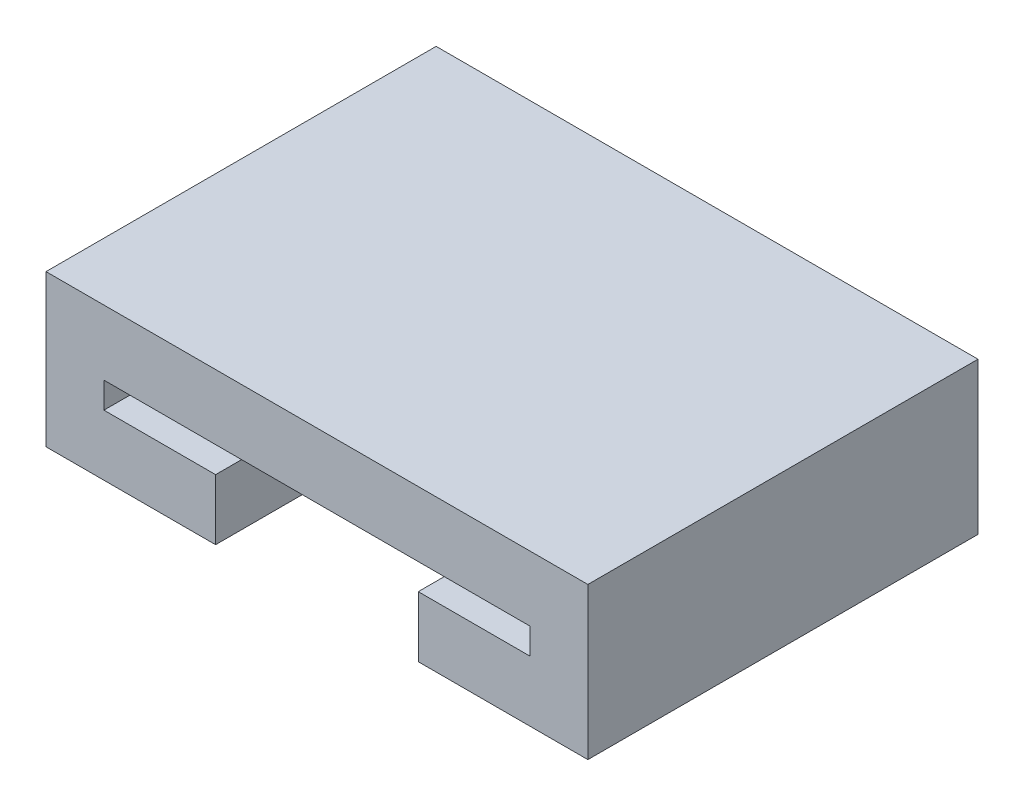
from build123d import *

# Parameters (mm, degrees)
SKETCH1_W           = 25
SKETCH1_H           = 18
BOSS_EXTRUDE1_DEPTH = 7
CUT_EXTRUDE1_DEPTH  = 13.5
SKETCH8_W           = 0.3
SKETCH8_H           = 2.8
CUT_EXTRUDE4_DEPTH  = 10


with BuildPart() as part:
    # Sketch1 → Boss-Extrude1 (new body)
    with BuildSketch(Plane(origin=(0, 0, 0), x_dir=(1, 0, 0), z_dir=(0, 1, 0))):
        Rectangle(SKETCH1_W, SKETCH1_H)
    extrude(amount=BOSS_EXTRUDE1_DEPTH)

    # Sketch2 → Cut-Extrude1 (cut)
    with BuildSketch(Plane.XY.offset(9)):
        Polygon((-4.675, 2.8), (-4.675, 0), (-0.725, 0), (-0.725, 2.8), (-0.425, 2.8), (-0.425, 0), (0.425, 0), (0.425, 2.8), (0.725, 2.8), (0.725, 0), (4.675, 0), (4.675, 2.8), (9.827302597, 2.8), (9.827302597, 4), (-9.827302597, 4), (-9.827302597, 2.8), align=None)
    extrude(amount=-CUT_EXTRUDE1_DEPTH, mode=Mode.SUBTRACT)

    # Sketch8 → Cut-Extrude4 (cut)
    with BuildSketch(Plane.XY.offset(9)):
        with Locations((-0.575, 1.4)):
            Rectangle(SKETCH8_W, SKETCH8_H)
        with Locations((0.575, 1.4)):
            Rectangle(SKETCH8_W, SKETCH8_H)
    extrude(amount=-CUT_EXTRUDE4_DEPTH, mode=Mode.SUBTRACT)


solid = part.part
